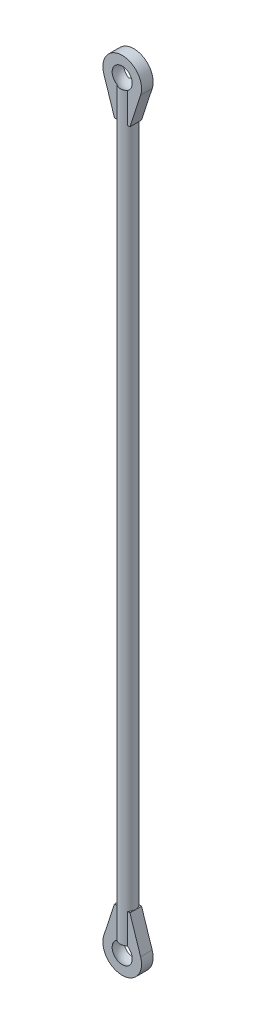
from build123d import *

# Parameters (mm, degrees)
ESQUISSE1_W        = 2
ESQUISSE1_H        = 196
BOSS_EXTRU_1_DEPTH = 1.5


with BuildPart() as part:
    # Esquisse1 → Révolution1 (revolve)
    with BuildSketch(Plane.XY):
        with Locations((1, 0)):
            Rectangle(ESQUISSE1_W, ESQUISSE1_H)
    revolve(axis=Axis((0, -98, 0), (0, 1, 0)))

    # Esquisse2 → Boss.-Extru.1 (add, symmetric)
    with BuildSketch(Plane.XY):
        with BuildLine():
            Line((2, 88), (4.753939624, 96.450787925))
            ThreePointArc((4.753939624, 96.450787925), (0, 103), (-4.753939624, 96.450787925))
            Line((-4.753939624, 96.450787925), (-2, 88))
            Line((-2, 88), (2, 88))
        make_face()
    boss_extru_1 = extrude(amount=BOSS_EXTRU_1_DEPTH, both=True)

    # Esquisse3 → Enlèvement de matière-Révolution1 (revolve, cut)
    with BuildSketch(Plane.XY):
        with BuildLine():
            Line((0, 101), (0, 95))
            ThreePointArc((0, 95), (-3, 98), (0, 101))
        make_face()
    enl_vement_de_mati_re_r_volution1 = revolve(axis=Axis((0, 95, 0), (0, 1, 0)), mode=Mode.SUBTRACT)

    # Symétrie1: Boss.-Extru.1, Enlèvement de matière-Révolution1 across plane
    add(boss_extru_1.mirror(Plane.ZX))
    add(enl_vement_de_mati_re_r_volution1.mirror(Plane.ZX), mode=Mode.SUBTRACT)


solid = part.part
